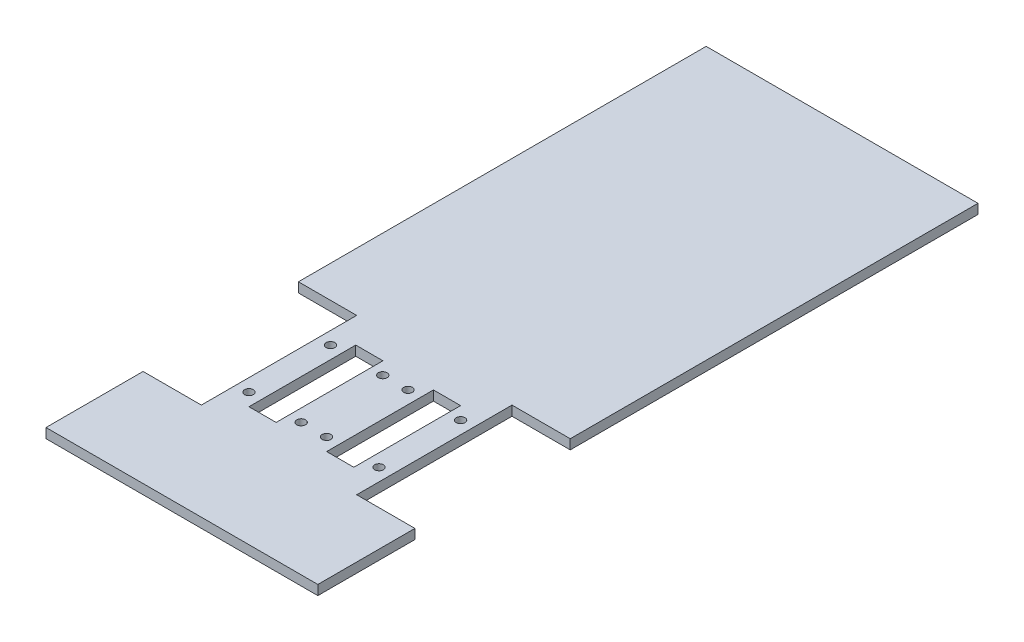
from build123d import *

# Parameters (mm, degrees)
SKETCH1_W           = 140
SKETCH1_H           = 340
BOSS_EXTRUDE1_DEPTH = 5
SKETCH3_W           = 30
SKETCH3_H           = 80
CUT_EXTRUDE1_DEPTH  = 184.915741577
SKETCH6_R           = 2.25
CUT_EXTRUDE2_DEPTH  = 184.915741577
SKETCH9_W           = 14
SKETCH9_H           = 55
CUT_EXTRUDE3_DEPTH  = 184.915741577


with BuildPart() as part:
    # Sketch1 → Boss-Extrude1 (new body)
    with BuildSketch(Plane(origin=(0, 0, 0), x_dir=(1, 0, 0), z_dir=(0, 1, 0))):
        Rectangle(SKETCH1_W, SKETCH1_H)
    extrude(amount=BOSS_EXTRUDE1_DEPTH)

    # Sketch3 → Cut-Extrude1 (cut, through all)
    with BuildSketch(Plane(origin=(0, 5, 0), x_dir=(1, 0, 0), z_dir=(0, 1, 0))):
        with Locations((-55, -80)):
            Rectangle(SKETCH3_W, SKETCH3_H)
        with Locations((55, -80)):
            Rectangle(SKETCH3_W, SKETCH3_H)
    extrude(amount=-CUT_EXTRUDE1_DEPTH, mode=Mode.SUBTRACT)

    # Sketch6 → Cut-Extrude2 (cut, through all)
    with BuildSketch(Plane(origin=(0, 0, 0), x_dir=(-1, 0, 0), z_dir=(0, -1, 0))):
        with Locations((-33.5, -101.973028737)):
            Circle(SKETCH6_R)
        with Locations((-33.5, -59.973028737)):
            Circle(SKETCH6_R)
        with Locations((33.5, -101.973028737)):
            Circle(SKETCH6_R)
        with Locations((33.5, -59.973028737)):
            Circle(SKETCH6_R)
        with Locations((6.61862519, -101.973028737)):
            Circle(SKETCH6_R)
        with Locations((-6.446238439, -101.973028737)):
            Circle(SKETCH6_R)
        with Locations((6.61862519, -59.973028737)):
            Circle(SKETCH6_R)
        with Locations((-6.446238439, -59.973028737)):
            Circle(SKETCH6_R)
    extrude(amount=-CUT_EXTRUDE2_DEPTH, mode=Mode.SUBTRACT)

    # Sketch9 → Cut-Extrude3 (cut, through all)
    with BuildSketch(Plane.XZ):
        with Locations((-20, 80.973028737)):
            Rectangle(SKETCH9_W, SKETCH9_H)
        with Locations((20, 80.973028737)):
            Rectangle(SKETCH9_W, SKETCH9_H)
    extrude(amount=-CUT_EXTRUDE3_DEPTH, mode=Mode.SUBTRACT)


solid = part.part
